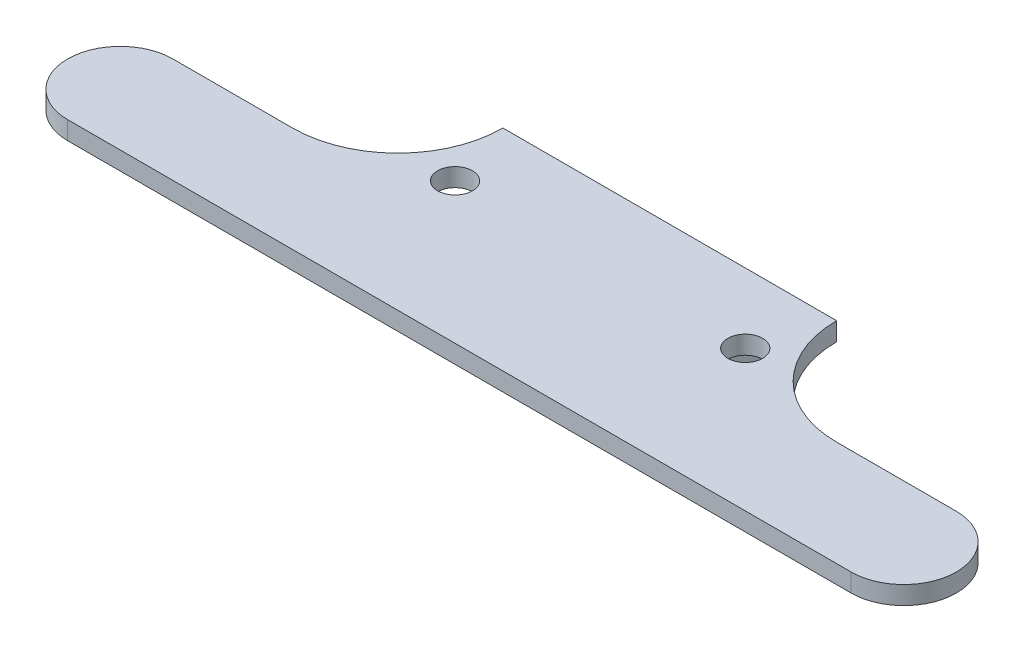
from build123d import *

# Parameters (mm, degrees)
SKETCH1_R           = 1.524
BOSS_EXTRUDE1_DEPTH = 1.6
SKETCH2_W           = 20.32
SKETCH2_H           = 7.366
BOSS_EXTRUDE2_DEPTH = 3.81


with BuildPart() as part:
    # Sketch1 → Boss-Extrude1 (new body)
    with BuildSketch(Plane(origin=(0, 0, 0), x_dir=(1, 0, 0), z_dir=(0, 1, 0))):
        with BuildLine():
            Line((-23.8125, 4.60375), (-34.29, 4.60375))
            ThreePointArc((-34.29, 4.60375), (-38.89375, 0), (-34.29, -4.60375))
            Line((-34.29, -4.60375), (34.29, -4.60375))
            ThreePointArc((34.29, -4.60375), (38.89375, 0), (34.29, 4.60375))
            Line((34.29, 4.60375), (23.8125, 4.60375))
            ThreePointArc((23.8125, 4.60375), (17.301814312, 7.300564312), (14.605, 13.81125))
            Line((14.605, 13.81125), (-14.605, 13.81125))
            ThreePointArc((-14.605, 13.81125), (-17.301814312, 7.300564312), (-23.8125, 4.60375))
        make_face()
        with Locations((12.7, 7.71525)):
            Circle(SKETCH1_R, mode=Mode.SUBTRACT)
        with Locations((-12.7, 7.71525)):
            Circle(SKETCH1_R, mode=Mode.SUBTRACT)
    extrude(amount=BOSS_EXTRUDE1_DEPTH)

    # Sketch2 → Boss-Extrude2 (add)
    with BuildSketch(Plane(origin=(0, 0, 0), x_dir=(1, 0, 0), z_dir=(0, 1, 0))):
        with Locations((0, 10.12825)):
            Rectangle(SKETCH2_W, SKETCH2_H)
    extrude(amount=-BOSS_EXTRUDE2_DEPTH)


solid = part.part
